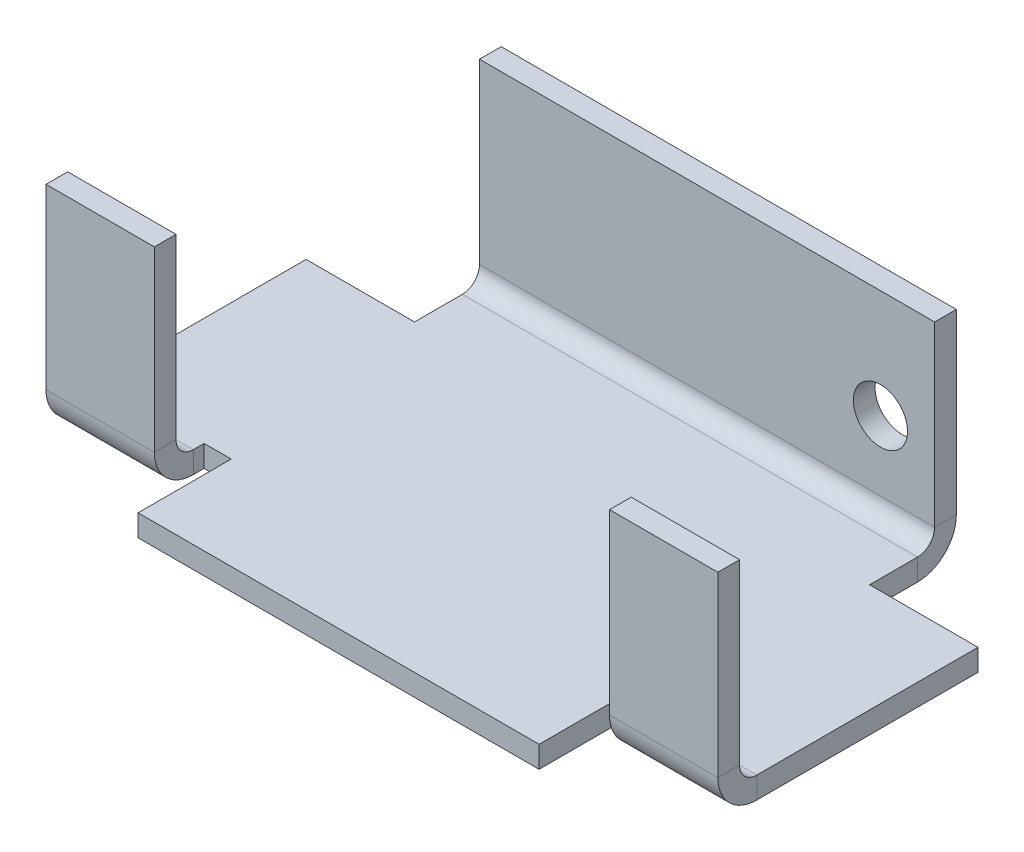
from build123d import *

# Parameters (mm, degrees)
SKETCH1_W                    = 42
SKETCH1_H                    = 36
BASE_FLANGE1_DEPTH           = 2
SKETCH6_W                    = 10
SKETCH6_H                    = 24
TAB1_DEPTH                   = 2
SKETCH9_W                    = 10
SKETCH9_H                    = 24
TAB2_DEPTH                   = 2
EDGE_FLANGE1_STRIP_W         = 11.175
EDGE_FLANGE1_STRIP_H         = 2
EDGE_FLANGE1_STRIP_CUT_DEPTH = 42
EDGE_FLANGE1_DEPTH           = 42
EDGE_FLANGE2_START           = -10
EDGE_FLANGE2_DEPTH           = 11
EDGE_FLANGE2_2_DEPTH         = 1
EDGE_FLANGE2_3_DEPTH         = 10
EDGE_FLANGE3_START           = 41
EDGE_FLANGE3_DEPTH           = 11
EDGE_FLANGE3_2_DEPTH         = 1
EDGE_FLANGE3_START_2         = 42
EDGE_FLANGE3_3_DEPTH         = 10
SKETCH21_W                   = 1
SKETCH21_H                   = 4
CUT_EXTRUDE1_DEPTH           = 10
SKETCH22_W                   = 1
SKETCH22_H                   = 4
CUT_EXTRUDE2_DEPTH           = 2
SKETCH23_W                   = 1.5
SKETCH23_H                   = 8.5875
CUT_EXTRUDE3_DEPTH           = 2
SKETCH24_W                   = 1.5
SKETCH24_H                   = 8.5875
CUT_EXTRUDE4_DEPTH           = 2
CUT_EXTRUDE5_REACH           = 67.757
SKETCH26_R                   = 2.5


# Read off the part's stored shape, not the designer's step: Edge-Flange2, Edge-Flange3
# Sheet-metal steps are written as plain solids
with BuildPart() as part:
    # Sketch1 → Base-Flange1 (new body)
    with BuildSketch(Plane(origin=(0, 0, 0), x_dir=(1, 0, 0), z_dir=(0, 1, 0))):
        with Locations((21, 18)):
            Rectangle(SKETCH1_W, SKETCH1_H)
    extrude(amount=-BASE_FLANGE1_DEPTH)

    # Sketch6 → Tab1 (add)
    with BuildSketch(Plane(origin=(0, 0, 0), x_dir=(1, 0, 0), z_dir=(0, 1, 0))):
        with Locations((47, 16)):
            Rectangle(SKETCH6_W, SKETCH6_H)
    extrude(amount=-TAB1_DEPTH)

    # Sketch9 → Tab2 (add)
    with BuildSketch(Plane(origin=(0, 0, 0), x_dir=(1, 0, 0), z_dir=(0, 1, 0))):
        with Locations((-5, 16)):
            Rectangle(SKETCH9_W, SKETCH9_H)
    extrude(amount=-TAB2_DEPTH)

    # Edge-Flange1 strip (across the edge) → Edge-Flange1 strip cut (cut)
    with BuildSketch(Plane(origin=(42, 0, -36), x_dir=(0, 0, 1), z_dir=(-1, 0, 0))):
        with Locations((-2, -1)):
            Rectangle(EDGE_FLANGE1_STRIP_W, EDGE_FLANGE1_STRIP_H)
    extrude(amount=EDGE_FLANGE1_STRIP_CUT_DEPTH, mode=Mode.SUBTRACT)

    # Edge-Flange1 section (across the edge) → Edge-Flange1 (add)
    with BuildSketch(Plane(origin=(42, 0, -36), x_dir=(0, 0, 1), z_dir=(-1, 0, 0))):
        with BuildLine():
            Line((0, 1.5875), (0, 18))
            Line((0, 18), (2, 18))
            Line((2, 18), (2, 1.5875))
            ThreePointArc((2, 1.5875), (2.464967985, 0.464967985), (3.5875, 0))
            Line((3.5875, 0), (3.5875, -2))
            ThreePointArc((3.5875, -2), (1.050754422, -0.949245578), (0, 1.5875))
        make_face()
    extrude(amount=EDGE_FLANGE1_DEPTH)

    # Edge-Flange2 outline → Edge-Flange2 (cut)
    with BuildSketch(Plane.YZ.offset(EDGE_FLANGE2_START)):
        with BuildLine():
            ThreePointArc((-2, -7.5875), (-1.45924519, -5.693430307), (0, -4.370358411))
            Line((0, -4.370358411), (0, -4))
            Line((0, -4), (-2, -4))
            Line((-2, -4), (-2, -7.5875))
        make_face()
    extrude(amount=EDGE_FLANGE2_DEPTH, mode=Mode.SUBTRACT)

    # Edge-Flange2 2 outline → Edge-Flange2 2 (cut)
    with BuildSketch(Plane.YZ):
        with BuildLine():
            Line((0, -8.5875), (0, -4.370358411))
            ThreePointArc((0, -4.370358411), (-1.45924519, -5.693430307), (-2, -7.5875))
            Line((-2, -7.5875), (-2, -8.5875))
            Line((-2, -8.5875), (0, -8.5875))
        make_face()
    extrude(amount=EDGE_FLANGE2_2_DEPTH, mode=Mode.SUBTRACT)

    # Edge-Flange2 3 outline → Edge-Flange2 3 (add)
    with BuildSketch(Plane.YZ.offset(EDGE_FLANGE2_START)):
        with BuildLine():
            Line((18, -4), (1.5875, -4))
            ThreePointArc((1.5875, -4), (0.77243534, -4.093816292), (0, -4.370358411))
            Line((0, -4.370358411), (0, -7.5875))
            ThreePointArc((0, -7.5875), (0.464967985, -6.464967985), (1.5875, -6))
            Line((1.5875, -6), (18, -6))
            Line((18, -6), (18, -4))
        make_face()
    extrude(amount=EDGE_FLANGE2_3_DEPTH)

    # Edge-Flange3 outline → Edge-Flange3 (cut)
    with BuildSketch(Plane.YZ.offset(EDGE_FLANGE3_START)):
        with BuildLine():
            ThreePointArc((-2, -7.5875), (-1.45924519, -5.693430307), (0, -4.370358411))
            Line((0, -4.370358411), (0, -4))
            Line((0, -4), (-2, -4))
            Line((-2, -4), (-2, -7.5875))
        make_face()
    extrude(amount=EDGE_FLANGE3_DEPTH, mode=Mode.SUBTRACT)

    # Edge-Flange3 2 outline → Edge-Flange3 2 (cut)
    with BuildSketch(Plane.YZ.offset(EDGE_FLANGE3_START)):
        with BuildLine():
            Line((0, -8.5875), (0, -4.370358411))
            ThreePointArc((0, -4.370358411), (-1.45924519, -5.693430307), (-2, -7.5875))
            Line((-2, -7.5875), (-2, -8.5875))
            Line((-2, -8.5875), (0, -8.5875))
        make_face()
    extrude(amount=EDGE_FLANGE3_2_DEPTH, mode=Mode.SUBTRACT)

    # Edge-Flange3 3 outline → Edge-Flange3 3 (add)
    with BuildSketch(Plane.YZ.offset(EDGE_FLANGE3_START_2)):
        with BuildLine():
            Line((18, -6), (18, -4))
            Line((18, -4), (1.5875, -4))
            ThreePointArc((1.5875, -4), (0.77243534, -4.093816292), (0, -4.370358411))
            Line((0, -4.370358411), (0, -7.5875))
            ThreePointArc((0, -7.5875), (0.464967985, -6.464967985), (1.5875, -6))
            Line((1.5875, -6), (18, -6))
        make_face()
    extrude(amount=EDGE_FLANGE3_3_DEPTH)

    # Sketch21 → Cut-Extrude1 (cut)
    with BuildSketch(Plane(origin=(0, 0, 0), x_dir=(1, 0, 0), z_dir=(0, 1, 0))):
        with Locations((0.5, 2)):
            Rectangle(SKETCH21_W, SKETCH21_H)
    extrude(amount=-CUT_EXTRUDE1_DEPTH, mode=Mode.SUBTRACT)

    # Sketch22 → Cut-Extrude2 (cut)
    with BuildSketch(Plane(origin=(0, 0, 0), x_dir=(1, 0, 0), z_dir=(0, 1, 0))):
        with Locations((41.5, 2)):
            Rectangle(SKETCH22_W, SKETCH22_H)
    extrude(amount=-CUT_EXTRUDE2_DEPTH, mode=Mode.SUBTRACT)

    # Sketch23 → Cut-Extrude3 (cut)
    with BuildSketch(Plane(origin=(0, 0, 0), x_dir=(1, 0, 0), z_dir=(0, 1, 0))):
        with Locations((1.75, 4.29375)):
            Rectangle(SKETCH23_W, SKETCH23_H)
    extrude(amount=-CUT_EXTRUDE3_DEPTH, mode=Mode.SUBTRACT)

    # Sketch24 → Cut-Extrude4 (cut)
    with BuildSketch(Plane(origin=(0, 0, 0), x_dir=(1, 0, 0), z_dir=(0, 1, 0))):
        with Locations((40.25, 4.29375)):
            Rectangle(SKETCH24_W, SKETCH24_H)
    extrude(amount=-CUT_EXTRUDE4_DEPTH, mode=Mode.SUBTRACT)

    # Sketch26 → Cut-Extrude5 (cut, up to next)
    with BuildSketch(Plane(origin=(0, 0, -36), x_dir=(-1, 0, 0), z_dir=(0, 0, -1)), mode=Mode.PRIVATE) as cut_extrude5_sk1:
        with Locations(Location((-37, 8, 0), (0, 0, 90))):
            Circle(SKETCH26_R)
    cut_extrude5_tool1 = extrude(cut_extrude5_sk1.sketch, amount=-CUT_EXTRUDE5_REACH, mode=Mode.PRIVATE) & part.part
    add(cut_extrude5_tool1.solids().sort_by_distance((37, 8, -36))[0], mode=Mode.SUBTRACT)


solid = part.part
